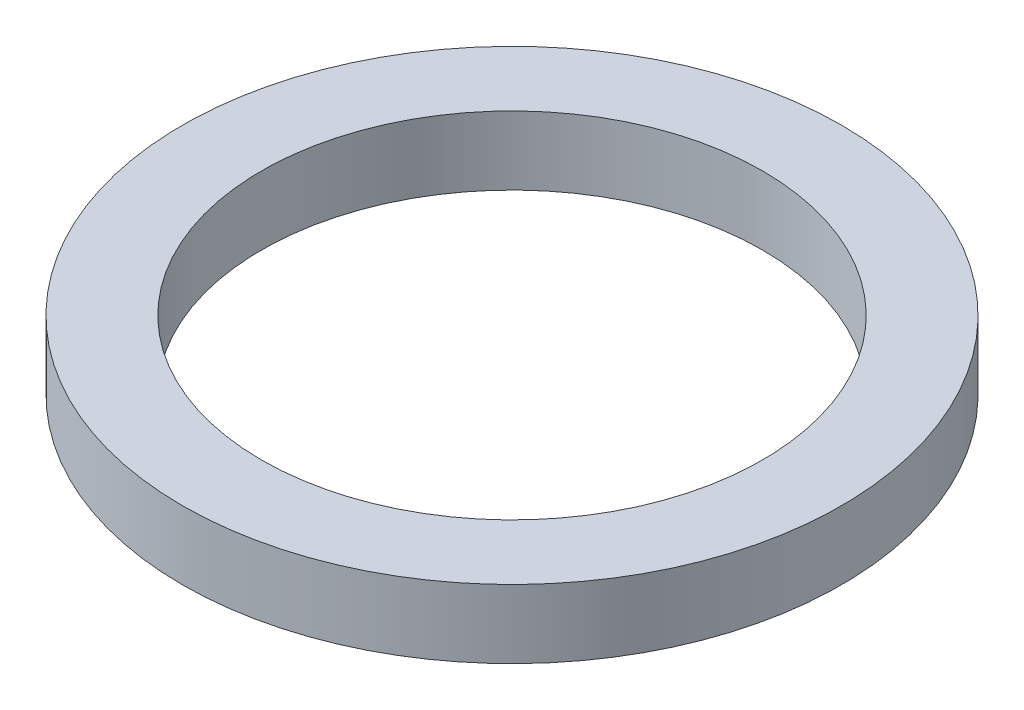
from build123d import *

# Parameters (mm, degrees)
SKETCH1_R           = 62.5
BOSS_EXTRUDE1_DEPTH = 13
SKETCH2_R           = 47.5
CUT_EXTRUDE1_DEPTH  = 90.339241098


with BuildPart() as part:
    # Sketch1 → Boss-Extrude1 (new body)
    with BuildSketch(Plane(origin=(0, 0, 0), x_dir=(1, 0, 0), z_dir=(0, 1, 0))):
        Circle(SKETCH1_R)
    extrude(amount=BOSS_EXTRUDE1_DEPTH)

    # Sketch2 → Cut-Extrude1 (cut, through all)
    with BuildSketch(Plane(origin=(0, 0, 0), x_dir=(1, 0, 0), z_dir=(0, 1, 0))):
        Circle(SKETCH2_R)
    extrude(amount=CUT_EXTRUDE1_DEPTH, mode=Mode.SUBTRACT)


solid = part.part
